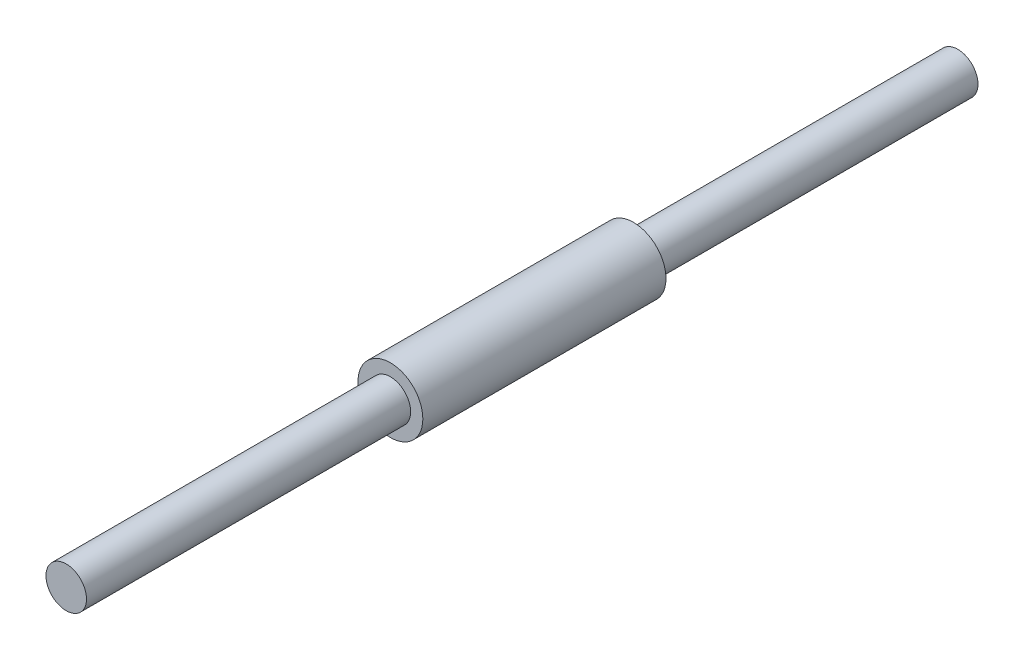
from build123d import *

# Parameters (mm, degrees)
BOSS_EXTRUDE1_DEPTH      = 69.85
BOSS_EXTRUDE1_DEPTH_BACK = 69.85
SKETCH2_R                = 3.175
BOSS_EXTRUDE2_DEPTH      = 19.05
BOSS_EXTRUDE2_DEPTH_BACK = 19.05
SKETCH3_R                = 5.08


with BuildPart() as part:
    # Sketch2 → Boss-Extrude1 (new, two sides: drawn at the far end of the back side and taken through both)
    with BuildSketch(Plane.XY.offset(-BOSS_EXTRUDE1_DEPTH_BACK)):
        Circle(SKETCH2_R)
    extrude(amount=BOSS_EXTRUDE1_DEPTH + BOSS_EXTRUDE1_DEPTH_BACK)

    # Sketch3 → Boss-Extrude2 (add, two sides: drawn at the far end of the back side and taken through both)
    with BuildSketch(Plane.XY.offset(-BOSS_EXTRUDE2_DEPTH_BACK)):
        Circle(SKETCH3_R)
    extrude(amount=BOSS_EXTRUDE2_DEPTH + BOSS_EXTRUDE2_DEPTH_BACK)


solid = part.part
